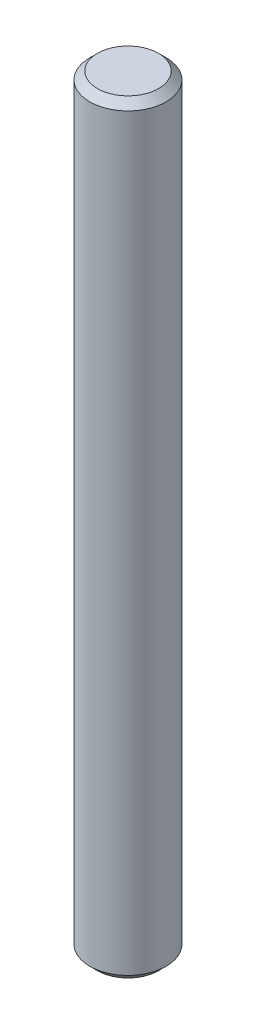
from build123d import *

# Parameters (mm, degrees)
SKETCH1_R           = 5
BOSS_EXTRUDE1_DEPTH = 100
CHAMFER1_SIZE       = 1


with BuildPart() as part:
    # Sketch1 → Boss-Extrude1 (new body)
    with BuildSketch(Plane(origin=(0, 0, 0), x_dir=(1, 0, 0), z_dir=(0, 1, 0))):
        Circle(SKETCH1_R)
    extrude(amount=BOSS_EXTRUDE1_DEPTH)

    # Chamfer1
    chamfer1_edges = [part.edges().sort_by_distance(p)[0] for p in [
        (-5, 0, 0),
        (-5, 100, 0),
    ]]
    chamfer(chamfer1_edges, length=CHAMFER1_SIZE)


solid = part.part
